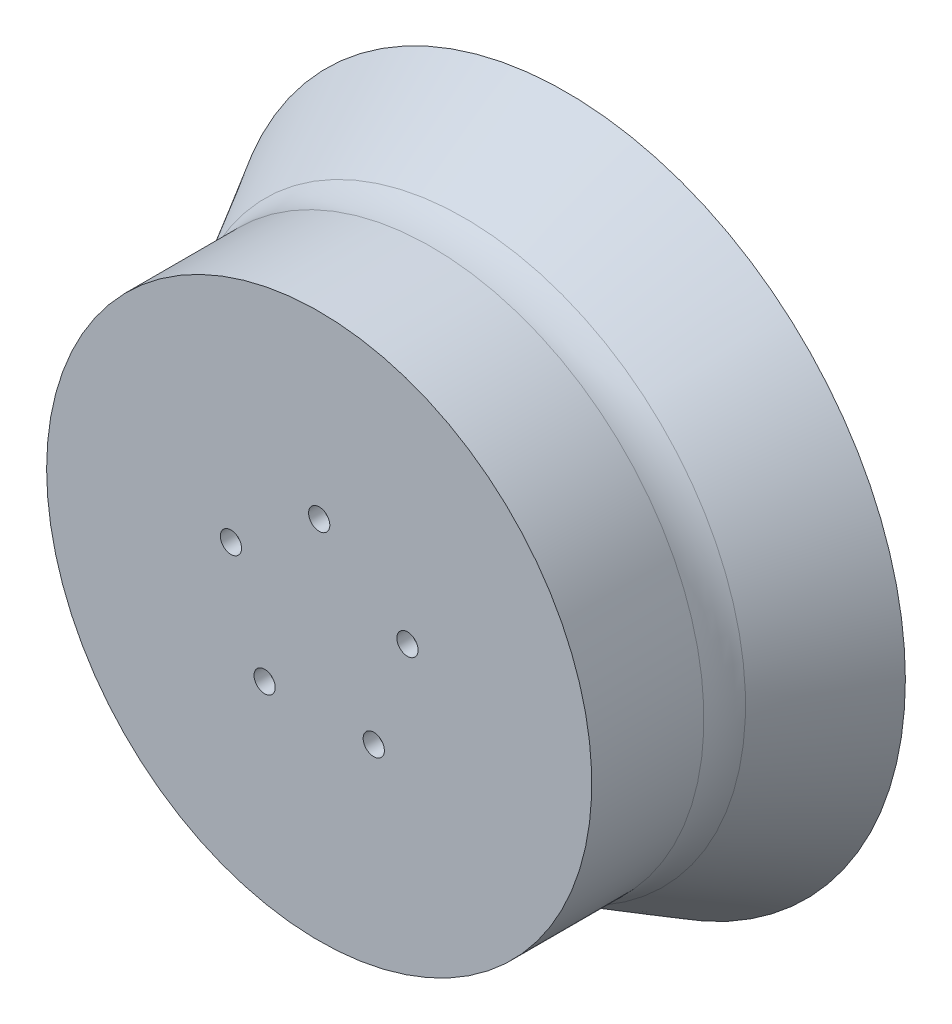
from build123d import *

# Parameters (mm, degrees)
SKETCH2_R          = 1.8288
CUT_EXTRUDE1_DEPTH = 94.009732492


with BuildPart() as part:
    # Sketch1 → Revolve1 (revolve)
    with BuildSketch(Plane(origin=(0, 0, 0), x_dir=(1, 0, 0), z_dir=(0, 1, 0))):
        with BuildLine():
            Line((7.7629, -25.4), (44.45, -25.4))
            Line((44.45, -25.4), (44.45, 0))
            Line((44.45, 0), (46.99, 0))
            Line((46.99, 0), (58.473357526, 14.633973945))
            Line((58.473357526, 14.633973945), (48.488896002, -2.93998396))
            ThreePointArc((48.488896002, -2.93998396), (47.371046022, -5.678922959), (46.99, -8.612551998))
            Line((46.99, -8.612551998), (46.99, -27.94))
            Line((46.99, -27.94), (0, -27.94))
            Line((0, -27.94), (0, -15.44))
            Line((0, -15.44), (5.7629, -15.44))
            Line((5.7629, -15.44), (7.7629, -17.44))
            Line((7.7629, -17.44), (7.7629, -25.4))
        make_face()
    revolve(axis=Axis((0, 0, 0), (0, 0, 1)))

    # Sketch2 → Cut-Extrude1 (cut, through all)
    with BuildSketch(Plane.XY.offset(27.94)):
        with Locations((0, 16)):
            Circle(SKETCH2_R)
        with Locations((15.216904261, 4.94427191)):
            Circle(SKETCH2_R)
        with Locations((9.404564037, -12.94427191)):
            Circle(SKETCH2_R)
        with Locations((-9.404564037, -12.94427191)):
            Circle(SKETCH2_R)
        with Locations((-15.216904261, 4.94427191)):
            Circle(SKETCH2_R)
    extrude(amount=-CUT_EXTRUDE1_DEPTH, mode=Mode.SUBTRACT)


solid = part.part
